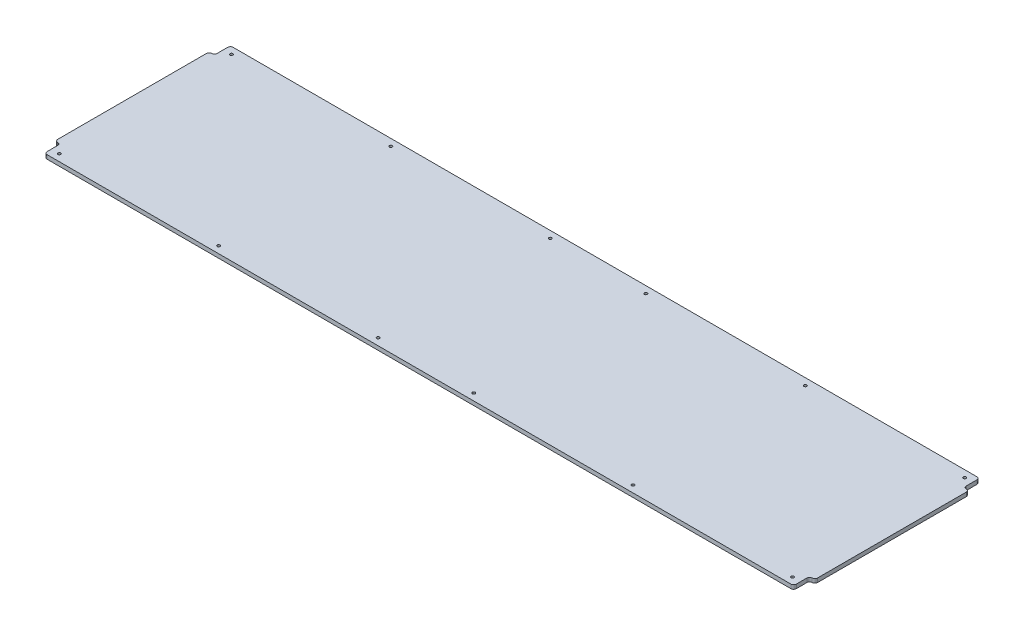
from build123d import *

# Parameters (mm, degrees)
BOSS_EXTRUDE1_DEPTH              = 9.525
F_17_64_0_26563_DIAMETER_HOLE1_D = 6.747002
FILLET1_R                        = 6.35


with BuildPart() as part:
    # Sketch1 → Boss-Extrude1 (new body)
    with BuildSketch(Plane(origin=(0, 0, 0), x_dir=(1, 0, 0), z_dir=(0, 1, 0))):
        Polygon((-895.35, 222.25), (-895.35, 184.15), (-908.05, 184.15), (-908.05, -184.15), (-895.35, -184.15), (-895.35, -222.25), (895.35, -222.25), (895.35, -184.15), (908.05, -184.15), (908.05, 184.15), (895.35, 184.15), (895.35, 222.25), align=None)
    extrude(amount=BOSS_EXTRUDE1_DEPTH)

    # 17/64 (0.26563) Diameter Hole1 (through all)
    with Locations(Plane(origin=(0, 9.525, 0), x_dir=(1, 0, 0), z_dir=(0, 1, 0))):
        with Locations((-876.3, -205.74), (-495.3, -205.74), (-876.3, 205.74), (-495.3, 205.74), (-114.3, 205.74), (-114.3, -205.74), (114.3, -205.74), (114.3, 205.74), (495.3, 205.74), (876.3, 205.74), (495.3, -205.74), (876.3, -205.74)):
            Hole(F_17_64_0_26563_DIAMETER_HOLE1_D / 2)

    # Fillet1
    fillet1_edges = [part.edges().sort_by_distance(p)[0] for p in [
        (895.35, 4.7625, 222.25),
        (895.35, 4.7625, 184.15),
        (908.05, 4.7625, 184.15),
        (908.05, 4.7625, -184.15),
        (895.35, 4.7625, -184.15),
        (895.35, 4.7625, -222.25),
        (-908.05, 4.7625, -184.15),
        (-895.35, 4.7625, -184.15),
        (-895.35, 4.7625, -222.25),
        (-895.35, 4.7625, 222.25),
        (-895.35, 4.7625, 184.15),
        (-908.05, 4.7625, 184.15),
    ]]
    fillet(fillet1_edges, radius=FILLET1_R - 0.0001)  # a hair under: the kernel refuses the full size


solid = part.part
